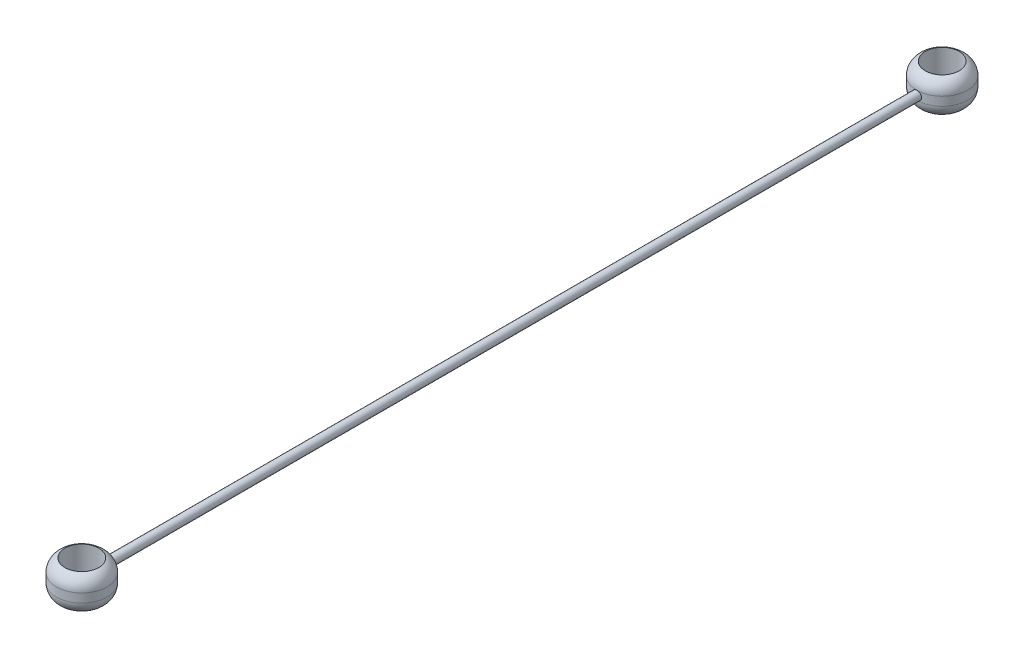
from build123d import *

# Parameters (mm, degrees)
SKETCH_1_R      = 7.5
SKETCH_1_R_2    = 5
EXTRUDE_1_DEPTH = 10
FILLET_1_R      = 4
SKETCH_4_R      = 1.3
EXTRUDE_3_DEPTH = 120


with BuildPart() as part:
    # 草图1 → 凸台-拉伸1 (new body)
    with BuildSketch(Plane(origin=(0, 0, 0), x_dir=(1, 0, 0), z_dir=(0, 1, 0))):
        with Locations(Location((0, 55.325090671, 0), (0, 0, 270))):
            Circle(SKETCH_1_R)
        with Locations(Location((0, 55.325090671, 0), (0, 0, 270))):
            Circle(SKETCH_1_R_2, mode=Mode.SUBTRACT)
    extrude(amount=EXTRUDE_1_DEPTH)

    # 圆角1
    # the kernel refuses this fillet: 4 mm, written as the material it takes off along each edge
    with BuildSketch(Plane(origin=(0, 0, -55.325090671), x_dir=(0, 0, 1), z_dir=(-1, 0, 0))) as fillet_1_piece_1:
        with BuildLine():
            CenterArc((3.5, 3.708099244), FILLET_1_R, 292.024312837, 67.975687163)
            Line((5, 0), (5.03, -0.074161985))
            ThreePointArc((5.03, -0.074161985), (6.25, -0.08), (7.5, -0.08))
            Line((7.5, -0.08), (7.58, 0))
            Line((7.58, 0), (7.58, 3.708099244))
            Line((7.58, 3.708099244), (7.5, 3.708099244))
        make_face()
    revolve(axis=Axis((0, 0, -55.325090671), (0, 1, 0)), mode=Mode.SUBTRACT)
    with BuildSketch(Plane(origin=(0, 10, -55.325090671), x_dir=(0, 0, 1), z_dir=(-1, 0, 0))) as fillet_1_piece_2:
        with BuildLine():
            CenterArc((3.5, -3.708099244), FILLET_1_R, 0, 67.975687163)
            Line((5, 0), (5.03, 0.074161985))
            ThreePointArc((5.03, 0.074161985), (6.25, 0.08), (7.5, 0.08))
            Line((7.5, 0.08), (7.58, 0))
            Line((7.58, 0), (7.58, -3.708099244))
            Line((7.58, -3.708099244), (7.5, -3.708099244))
        make_face()
    revolve(axis=Axis((0, 10, -55.325090671), (0, 1, 0)), mode=Mode.SUBTRACT)

    # 草图4 → 凸台-拉伸3 (add)
    with BuildSketch(Plane.XY.offset(-48)):
        with Locations(Location((0, 4.987305738, 0), (0, 0, 259.738510759))):
            Circle(SKETCH_4_R)
    extrude_3 = extrude(amount=EXTRUDE_3_DEPTH)

    # 镜向6: 凸台-拉伸3 across plane
    add(extrude_3.mirror(Plane.XY.offset(72)))

    # 镜向7: read off the stored shape, not the designer's step
    # 镜向7 outline → 镜向7 (revolve)
    with BuildSketch(Plane.XY.offset(199.325090671)):
        with BuildLine():
            Line((7.5, 3.708099244), (7.5, 6.291900756))
            ThreePointArc((7.5, 6.291900756), (6.81662479, 8.527968734), (5, 10))
            Line((5, 10), (5, 0))
            ThreePointArc((5, 0), (6.81662479, 1.472031266), (7.5, 3.708099244))
        make_face()
    revolve(axis=Axis((0, 0, 199.325090671), (0, 1, 0)))


solid = part.part
